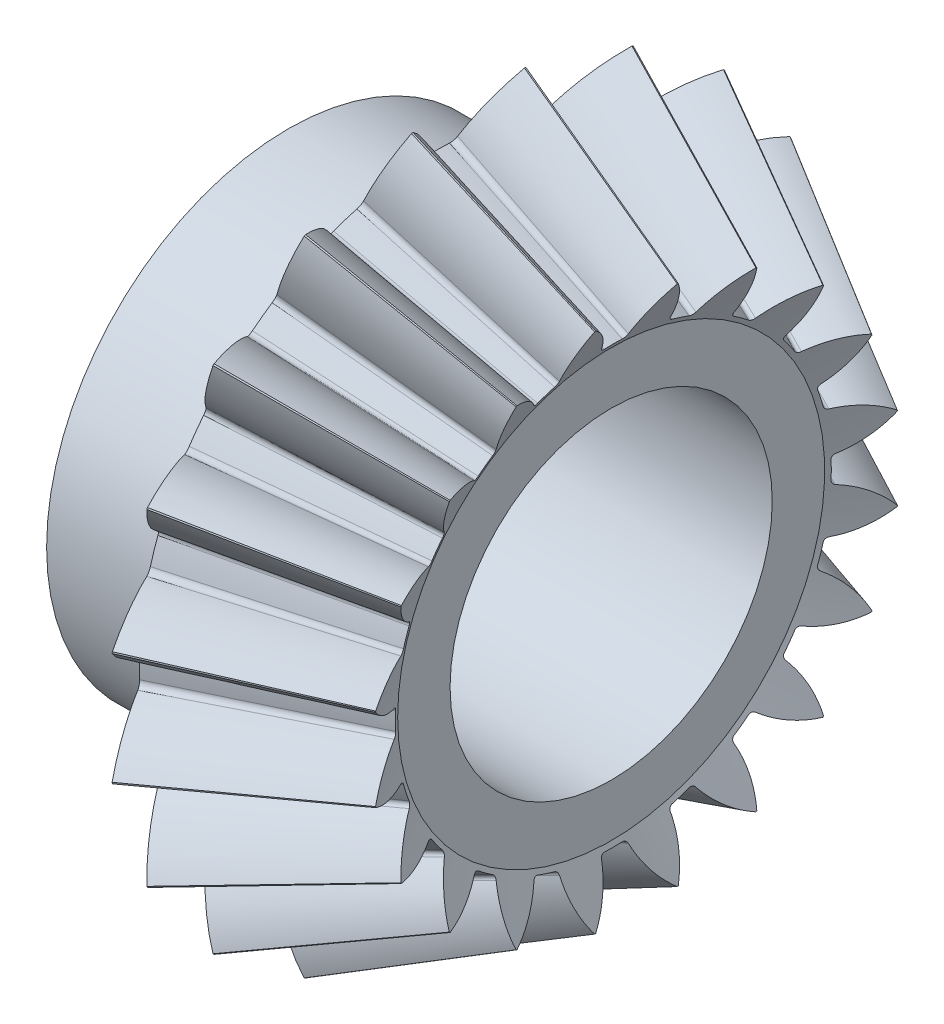
from build123d import *

# Parameters (mm, degrees)
TEETHCUTS_COUNT = 20
TEETHCUTS_ANGLE = 342
HUBSKE_R        = 15
HUB_DEPTH       = 9.05703993
BORSKE_R        = 10
BORE_DEPTH      = 50.0000508


with BuildPart() as part:
    # BasProSke → Base-Revolve (revolve)
    with BuildSketch(Plane(origin=(0, 0, 0), x_dir=(1, 0, 0), z_dir=(0, 1, 0)), mode=Mode.PRIVATE) as base_revolve_sk:
        Polygon((0, 0), (0, 18.113876661), (2.146066244, 22.406009143), (12.556392532, 16.393845991), (10.98617629, 13.25341351), (10.98617629, 0), align=None)
    revolve(base_revolve_sk.sketch.rotate(Axis((-10, 0, 0), (1, 0, 0)), 180), axis=Axis((-10, 0, 0), (1, 0, 0)))

    # ToothCut: read off the stored shape, not the designer's step
    # ToothCut: loft between two sections, ruled curve by curve
    toothcut_from = [
        Edge.make_bspline([(40.946429901, 0.006736461, -0.010225691), (40.943871055, 0.001618769, -0.014439983), (40.940716651, -0.00469004, -0.01357547), (40.938688706, -0.008745929, -0.008104096)], [0, 0, 0, 0, 1, 1, 1, 1], 3, [1, 0.818030257, 0.818030257, 1]),
        Edge.make_bspline([(40.938688706, -0.008745929, 0.008104096), (40.940716651, -0.00469004, 0.01357547), (40.943871055, 0.001618769, 0.014439983), (40.946429901, 0.006736461, 0.010225691)], [0, 0, 0, 0, 1, 1, 1, 1], 3, [1, 0.818030257, 0.818030257, 1]),
        Edge.make_bspline([(40.938688706, -0.008745929, -0.008104096), (40.938370305, -0.009382732, -0.007245052), (40.938104983, -0.009913374, -0.00630013), (40.937897317, -0.010328708, -0.005285622)], [0, 0, 0, 0, 1, 1, 1, 1], 3, [1, 0.994252987, 0.994252987, 1]),
        Edge.make_bspline([(40.937897317, -0.010328708, 0.005285622), (40.938104983, -0.009913374, 0.00630013), (40.938370305, -0.009382732, 0.007245052), (40.938688706, -0.008745929, 0.008104096)], [0, 0, 0, 0, 1, 1, 1, 1], 3, [1, 0.994252987, 0.994252987, 1]),
        Edge.make_bspline([(40.937897317, -0.010328708, -0.005285622), (40.937199234, -0.011724873, -0.001875295), (40.937199234, -0.011724873, 0.001875295), (40.937897317, -0.010328708, 0.005285622)], [0, 0, 0, 0, 1, 1, 1, 1], 3, [1, 0.93951824, 0.93951824, 1]),
        Edge.make_line((40.946429901, 0.006736461, 0.010225691), (40.946429901, 0.006736461, -0.010225691)),
    ]
    toothcut_to = [
        Edge.make_bspline([(2.201960303, 22.517797262, -3.887419831), (1.715589733, 21.545056122, -2.525614981), (1.061854537, 20.237585732, -1.576696873), (0.307591977, 18.729060616, -1.137681986)], [0, 0, 0, 0, 1, 1, 1, 1], 3, [1, 0.965920318, 0.965920318, 1]),
        Edge.make_bspline([(0.307591977, 18.729060616, 1.137681986), (1.061854537, 20.237585732, 1.576696873), (1.715589733, 21.545056122, 2.525614981), (2.201960303, 22.517797262, 3.887419831)], [0, 0, 0, 0, 1, 1, 1, 1], 3, [1, 0.965920318, 0.965920318, 1]),
        Edge.make_bspline([(0.307591977, 18.729060616, -1.137681986), (0.227459683, 18.568796026, -1.09104137), (0.178183705, 18.47024407, -0.942243989), (0.181607623, 18.477091907, -0.757250329)], [0, 0, 0, 0, 1, 1, 1, 1], 3, [1, 0.852236456, 0.852236456, 1]),
        Edge.make_bspline([(0.181607623, 18.477091907, 0.757250329), (0.178183705, 18.47024407, 0.942243989), (0.227459683, 18.568796026, 1.09104137), (0.307591977, 18.729060616, 1.137681986)], [0, 0, 0, 0, 1, 1, 1, 1], 3, [1, 0.852236456, 0.852236456, 1]),
        Edge.make_bspline([(0.181607623, 18.477091907, -0.757250329), (0.19094857, 18.495773801, -0.252560786), (0.19094857, 18.495773801, 0.252560786), (0.181607623, 18.477091907, 0.757250329)], [0, 0, 0, 0, 1, 1, 1, 1], 3, [1, 0.999429804, 0.999429804, 1]),
        Edge.make_line((2.201960303, 22.517797262, 3.887419831), (2.201960303, 22.517797262, -3.887419831)),
    ]
    toothcut = Solid(Shell([*[Face.make_surface_from_curves(toothcut_from[k], toothcut_to[k]) for k in range(6)], Face(Wire(toothcut_from)), Face(Wire(toothcut_to))]))
    add(toothcut, mode=Mode.SUBTRACT)

    # TeethCuts: ToothCut ×20 about axis
    teethcuts_axis = Axis((-10, 0, 0), (1, 0, 0))
    for i in range(1, TEETHCUTS_COUNT):
        add(toothcut.rotate(teethcuts_axis, i * TEETHCUTS_ANGLE / (TEETHCUTS_COUNT - 1)), mode=Mode.SUBTRACT)

    # HubSke → Hub (add)
    with BuildSketch(Plane.ZY):
        with Locations(Location((0, 0, 0), (0, 0, 180))):
            Circle(HUBSKE_R)
    extrude(amount=HUB_DEPTH)

    # BorSke → Bore (cut, symmetric)
    with BuildSketch(Plane(origin=(0, 0, 0), x_dir=(0, 0, -1), z_dir=(1, 0, 0))):
        with Locations(Location((0, 0, 0), (0, 0, 180))):
            Circle(BORSKE_R)
    extrude(amount=BORE_DEPTH, both=True, mode=Mode.SUBTRACT)


solid = part.part
